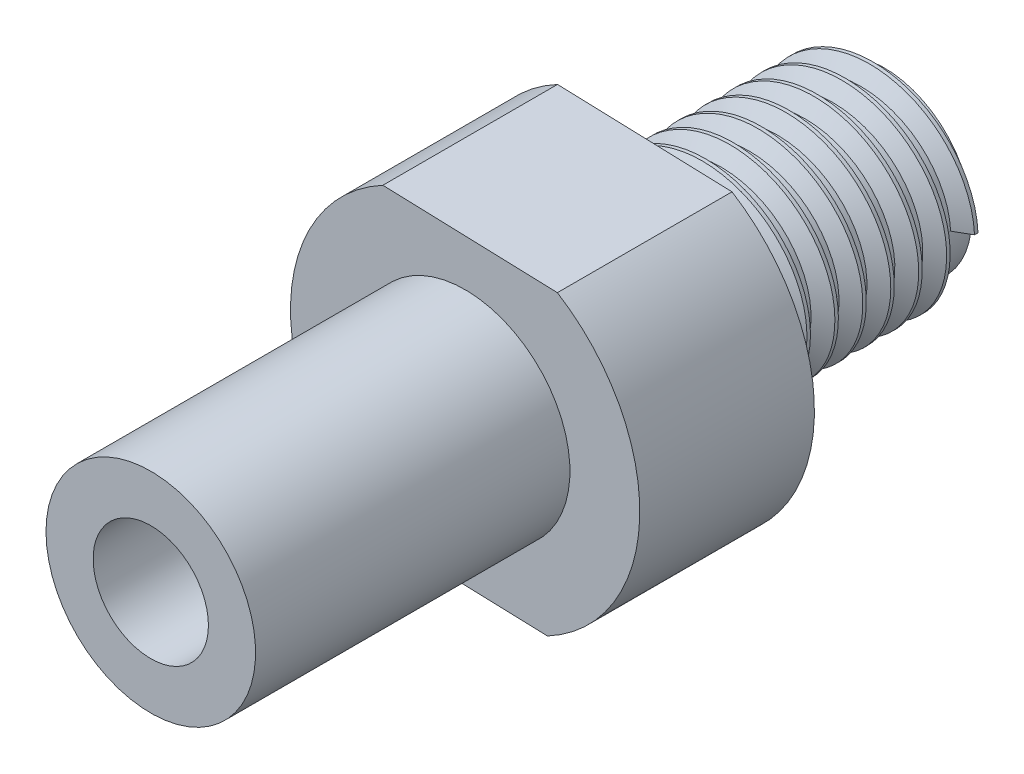
from build123d import *

# Parameters (mm, degrees)
SKETCH1_R                 = 2.5
BOSS_EXTRUDE1_DEPTH       = 7
THREAD1_PITCH             = 0.8
SKETCH4_R                 = 5
BOSS_EXTRUDE2_DEPTH       = 5
SKETCH11_R                = 3
BOSS_EXTRUDE3_DEPTH       = 9
M4X0_7_TAPPED_HOLE1_D     = 3.3
M4X0_7_TAPPED_HOLE1_DEPTH = 6
M4X0_7_TAPPED_HOLE1_TIP   = 0.991420021
CUT_EXTRUDE2_START        = -9
CUT_EXTRUDE2_DEPTH        = 9


with BuildPart() as part:
    # Sketch1 → Boss-Extrude1 (new body)
    with BuildSketch(Plane.XY):
        Circle(SKETCH1_R)
    extrude(amount=BOSS_EXTRUDE1_DEPTH)

    # Thread1: the profile of Thread Profile1 profile screwed along a right-hand helix of 7.5 turns, 8 arcs to a turn; built about Z, then put on its axis
    thread1_z = Axis((0, 0, 0), (0, 0, 1))
    thread1_corners = [(2.4997, 0, -0.000173205), (2.9330127, 0, 0.249999999), (2.9330127, 0, 0.349999999), (2.4997, 0, 0.600173203)]
    with BuildLine(mode=Mode.PRIVATE) as thread1_profile:
        Line(thread1_corners[0], thread1_corners[1])
        Line(thread1_corners[1], thread1_corners[2])
        Line(thread1_corners[2], thread1_corners[3])
        Line(thread1_corners[3], thread1_corners[0])
    thread1_cap = Face(thread1_profile.wire())
    thread1_turn_angles = [0, 22.5, 45, 67.5, 90, 112.5, 135, 157.5, 180, 202.5, 225, 247.5, 270, 292.5, 315, 337.5, 360]
    thread1_turn_weights = [1, 0.9238795325112867, 1, 0.9238795325112867, 1, 0.9238795325112867, 1, 0.9238795325112867, 1, 0.9238795325112867, 1, 0.9238795325112867, 1, 0.9238795325112867, 1, 0.9238795325112867, 1]
    thread1_turn_rails = [Edge.make_bspline([Vector(p[0], p[1], 0).rotate(thread1_z, thread1_turn_angles[k]) / thread1_turn_weights[k] + Vector(0, 0, p[2] + THREAD1_PITCH * thread1_turn_angles[k] / 360) for k in range(17)], [0, 0, 0, 1, 1, 2, 2, 3, 3, 4, 4, 5, 5, 6, 6, 7, 7, 8, 8, 8], 2, thread1_turn_weights) for p in thread1_corners]
    thread1_turn_sides = [Face.make_surface_from_curves(thread1_turn_rails[p[0]], thread1_turn_rails[p[1]]) for p in [(0, 1), (1, 2), (2, 3), (3, 0)]]
    thread1_last_angles = [2520, 2542.5, 2565, 2587.5, 2610, 2632.5, 2655, 2677.5, 2700]
    thread1_last_weights = [1, 0.9238795325112867, 1, 0.9238795325112867, 1, 0.9238795325112867, 1, 0.9238795325112867, 1]
    thread1_last_rails = [Edge.make_bspline([Vector(p[0], p[1], 0).rotate(thread1_z, thread1_last_angles[k]) / thread1_last_weights[k] + Vector(0, 0, p[2] + THREAD1_PITCH * thread1_last_angles[k] / 360) for k in range(9)], [0, 0, 0, 1, 1, 2, 2, 3, 3, 4, 4, 4], 2, thread1_last_weights) for p in thread1_corners]
    thread1_last_sides = [Face.make_surface_from_curves(thread1_last_rails[p[0]], thread1_last_rails[p[1]]) for p in [(0, 1), (1, 2), (2, 3), (3, 0)]]
    thread1 = Plane(origin=(0, 0, 0), x_dir=(1, 0, 0), z_dir=(0, 0, 1)) * Solid(Shell([*[p.moved(Location((0, 0, THREAD1_PITCH * i))) for i in range(7) for p in thread1_turn_sides], *thread1_last_sides, thread1_cap, thread1_cap.rotate(thread1_z, 2700).moved(Location((0, 0, THREAD1_PITCH * 2700 / 360)))]))
    add(thread1)

    # Sketch4 → Boss-Extrude2 (add)
    with BuildSketch(Plane.XY.offset(7)):
        Circle(SKETCH4_R)
    extrude(amount=BOSS_EXTRUDE2_DEPTH)

    # Sketch11 → Boss-Extrude3 (add)
    with BuildSketch(Plane.XY.offset(12)):
        Circle(SKETCH11_R)
    extrude(amount=BOSS_EXTRUDE3_DEPTH)

    # M4x0.7 Tapped Hole1
    with Locations(Plane.XY.offset(21)):
        with Locations((0, 0)):
            Hole(M4X0_7_TAPPED_HOLE1_D / 2, depth=M4X0_7_TAPPED_HOLE1_DEPTH)
            with Locations((0, 0, -(M4X0_7_TAPPED_HOLE1_DEPTH + M4X0_7_TAPPED_HOLE1_TIP / 2))):  # 118° drill point
                Cone(0, M4X0_7_TAPPED_HOLE1_D / 2, M4X0_7_TAPPED_HOLE1_TIP, mode=Mode.SUBTRACT)

    # Sketch14 → Cut-Extrude2 (cut)
    with BuildSketch(Plane.XY.offset(12).offset(CUT_EXTRUDE2_START)):
        with BuildLine():
            Line((-2.356366998, 4.409935892), (2.640933012, 4.245641627))
            ThreePointArc((2.640933012, 4.245641627), (0.164294265, 4.99730001), (-2.356366998, 4.409935892))
        make_face()
        with BuildLine():
            ThreePointArc((-2.640933012, -4.245641627), (-0.164294265, -4.99730001), (2.356366998, -4.409935892))
            Line((2.356366998, -4.409935892), (-2.640933012, -4.245641627))
        make_face()
    extrude(amount=CUT_EXTRUDE2_DEPTH, mode=Mode.SUBTRACT)


solid = part.part
